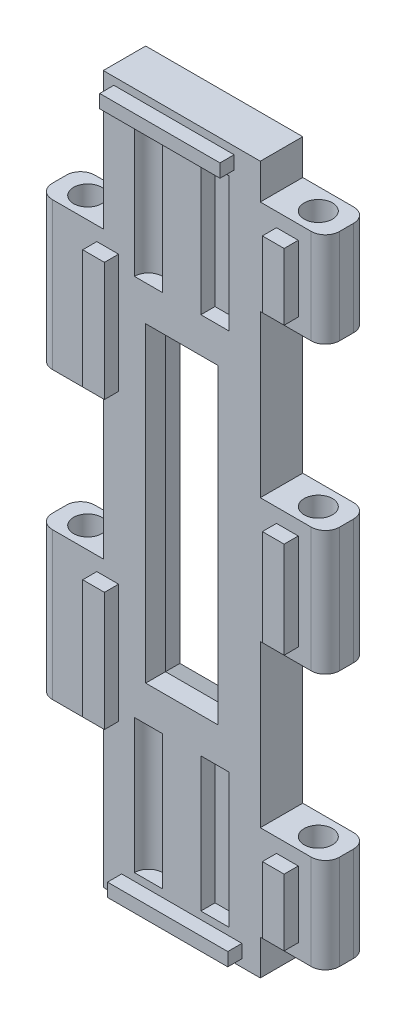
from build123d import *
from OCP.BRepFilletAPI import BRepFilletAPI_MakeChamfer

# Parameters (mm, degrees)
SKIZZE1_W                            = 4.6
SKIZZE1_H                            = 10.4
SKIZZE1_W_2                          = 11.1
SKIZZE1_H_2                          = 50
SKIZZE1_H_3                          = 6.7
SKIZZE1_H_4                          = 8.8
AUFSATZ_LINEAR_AUSTRAGEN1_DEPTH      = 3
SCHNITT_LINEAR_AUSTRAGEN1_DEPTH      = 37.5
SCHNITT_LINEAR_AUSTRAGEN1_DEPTH_BACK = 67.5
SKIZZE2_R                            = 1
SKIZZE3_W                            = 5.1
SKIZZE3_H                            = 22
SCHNITT_LINEAR_AUSTRAGEN2_DEPTH      = 7.5
VERRUNDUNG4_R                        = 1
SKIZZE4_W                            = 2
SKIZZE4_H                            = 9.5
SCHNITT_LINEAR_AUSTRAGEN3_DEPTH      = 1
VERRUNDUNG5_R                        = 1
SKIZZE7_W                            = 8.5
SKIZZE7_H                            = 0.94
SKIZZE7_W_2                          = 1.53828676
SKIZZE7_H_2                          = 8.4
SKIZZE7_H_3                          = 4.7
SKIZZE7_H_4                          = 6.8
AUFSATZ_LINEAR_AUSTRAGEN4_DEPTH      = 1
FASE1_SIZE                           = 1.6
FASE1_SIZE2                          = 0.582352375


with BuildPart() as part:
    # Skizze1 → Aufsatz-Linear austragen1 (new body)
    with BuildSketch(Plane.XY):
        with Locations((-18, 14.120550309)):
            Rectangle(SKIZZE1_W, SKIZZE1_H)
        with Locations((-10.15, 24.220550309)):
            Rectangle(SKIZZE1_W_2, SKIZZE1_H_2)
        with Locations((-18, 34.320550309)):
            Rectangle(SKIZZE1_W, SKIZZE1_H)
        with Locations((-2.3, 43.370550309)):
            Rectangle(SKIZZE1_W, SKIZZE1_H_3)
        with Locations((-2.3, 5.070550309)):
            Rectangle(SKIZZE1_W, SKIZZE1_H_3)
        with Locations((-2.3, 24.220550309)):
            Rectangle(SKIZZE1_W, SKIZZE1_H_4)
    extrude(amount=AUFSATZ_LINEAR_AUSTRAGEN1_DEPTH)

    # Skizze2 → Schnitt-Linear austragen1 (cut, two sides: drawn at the far end of the back side and taken through both)
    with BuildSketch(Plane(origin=(0, 39.520550309, 0), x_dir=(1, 0, 0), z_dir=(0, 1, 0)).offset(-SCHNITT_LINEAR_AUSTRAGEN1_DEPTH_BACK)):
        with Locations(Location((-18.3, -1.5, 0), (0, 0, 270))):
            Circle(SKIZZE2_R)
        with Locations(Location((-2, -1.5, 0), (0, 0, 90))):
            Circle(SKIZZE2_R)
    extrude(amount=SCHNITT_LINEAR_AUSTRAGEN1_DEPTH + SCHNITT_LINEAR_AUSTRAGEN1_DEPTH_BACK, mode=Mode.SUBTRACT)

    # Skizze3 → Schnitt-Linear austragen2 (cut)
    with BuildSketch(Plane.XY.offset(3)):
        with Locations((-10.15, 24.220550309)):
            Rectangle(SKIZZE3_W, SKIZZE3_H)
    extrude(amount=-SCHNITT_LINEAR_AUSTRAGEN2_DEPTH, mode=Mode.SUBTRACT)

    # Verrundung4
    verrundung4_edges = [part.edges().sort_by_distance(p)[0] for p in [
        (-20.3, 14.120550309, 3),
        (-20.3, 34.320550309, 3),
        (-20.3, 34.320550309, 0),
        (0, 43.370550309, 0),
        (0, 24.220550309, 0),
        (0, 5.070550309, 0),
        (-20.3, 14.120550309, 0),
        (0, 5.070550309, 3),
        (0, 24.220550309, 3),
        (0, 43.370550309, 3),
    ]]
    fillet(verrundung4_edges, radius=VERRUNDUNG4_R)

    # Skizze4 → Schnitt-Linear austragen3 (cut)
    with BuildSketch(Plane.XY.offset(3)):
        with Locations((-12.5, 42.470550309)):
            Rectangle(SKIZZE4_W, SKIZZE4_H)
        with Locations((-12.5, 5.970550309)):
            Rectangle(SKIZZE4_W, SKIZZE4_H)
        with Locations((-7.8, 42.470550309)):
            Rectangle(SKIZZE4_W, SKIZZE4_H)
        with Locations((-7.8, 5.970550309)):
            Rectangle(SKIZZE4_W, SKIZZE4_H)
    extrude(amount=-SCHNITT_LINEAR_AUSTRAGEN3_DEPTH, mode=Mode.SUBTRACT)

    # Verrundung5
    verrundung5_edges = [part.edges().sort_by_distance(p)[0] for p in [
        (-6.8, 5.970550309, 2),
        (-13.5, 5.970550309, 2),
        (-13.5, 42.470550309, 2),
        (-6.8, 42.470550309, 2),
    ]]
    fillet(verrundung5_edges, radius=VERRUNDUNG5_R - 0.0001)  # a hair under: the kernel refuses the full size

    # Skizze7 → Aufsatz-Linear austragen4 (add)
    with BuildSketch(Plane.XY.offset(3)):
        with Locations((-10.7, 48.220550309)):
            Rectangle(SKIZZE7_W, SKIZZE7_H)
        with Locations((-10.15, 0.220550309)):
            Rectangle(SKIZZE7_W, SKIZZE7_H)
        with Locations((-15.385238006, 14.120550309)):
            Rectangle(SKIZZE7_W_2, SKIZZE7_H_2)
        with Locations((-2.685428708, 5.070550309)):
            Rectangle(SKIZZE7_W_2, SKIZZE7_H_3)
        with Locations((-2.685428708, 24.220550309)):
            Rectangle(SKIZZE7_W_2, SKIZZE7_H_4)
        with Locations((-15.385238006, 34.320550309)):
            Rectangle(SKIZZE7_W_2, SKIZZE7_H_2)
        with Locations((-2.685428708, 43.370550309)):
            Rectangle(SKIZZE7_W_2, SKIZZE7_H_3)
    extrude(amount=AUFSATZ_LINEAR_AUSTRAGEN4_DEPTH)

    # Fase1: one chamfer whose edges measure the first distance from different faces: ONE call of the kernel's chamfer builder (chamfer() names one face for all edges)
    fase1_edges_1 = [part.edges().sort_by_distance(p)[0] for p in [
        (-10.15, 35.220550309, 0),
    ]]
    fase1_side_1 = [part.faces().sort_by_distance(p)[0] for p in [
        (-10.15, 35.220550309, 1.5),
    ]]
    fase1_edges_2 = [part.edges().sort_by_distance(p)[0] for p in [
        (-12.7, 24.220550309, 0),
    ]]
    fase1_side_2 = [part.faces().sort_by_distance(p)[0] for p in [
        (-12.7, 24.220550309, 1.5),
    ]]
    fase1_edges_3 = [part.edges().sort_by_distance(p)[0] for p in [
        (-10.15, 13.220550309, 0),
    ]]
    fase1_side_3 = [part.faces().sort_by_distance(p)[0] for p in [
        (-10.15, 13.220550309, 1.5),
    ]]
    fase1_edges_4 = [part.edges().sort_by_distance(p)[0] for p in [
        (-7.6, 24.220550309, 0),
    ]]
    fase1_side_4 = [part.faces().sort_by_distance(p)[0] for p in [
        (-7.6, 24.220550309, 1.5),
    ]]
    fase1 = BRepFilletAPI_MakeChamfer(part.part.solid().wrapped)
    for e in fase1_edges_1:
        fase1.Add(FASE1_SIZE, FASE1_SIZE2, e.wrapped, fase1_side_1[0].wrapped)  # the first distance lies on this face
    for e in fase1_edges_2:
        fase1.Add(FASE1_SIZE, FASE1_SIZE2, e.wrapped, fase1_side_2[0].wrapped)  # the first distance lies on this face
    for e in fase1_edges_3:
        fase1.Add(FASE1_SIZE, FASE1_SIZE2, e.wrapped, fase1_side_3[0].wrapped)  # the first distance lies on this face
    for e in fase1_edges_4:
        fase1.Add(FASE1_SIZE, FASE1_SIZE2, e.wrapped, fase1_side_4[0].wrapped)  # the first distance lies on this face
    add(Compound.cast(fase1.Shape()), mode=Mode.REPLACE)


solid = part.part
